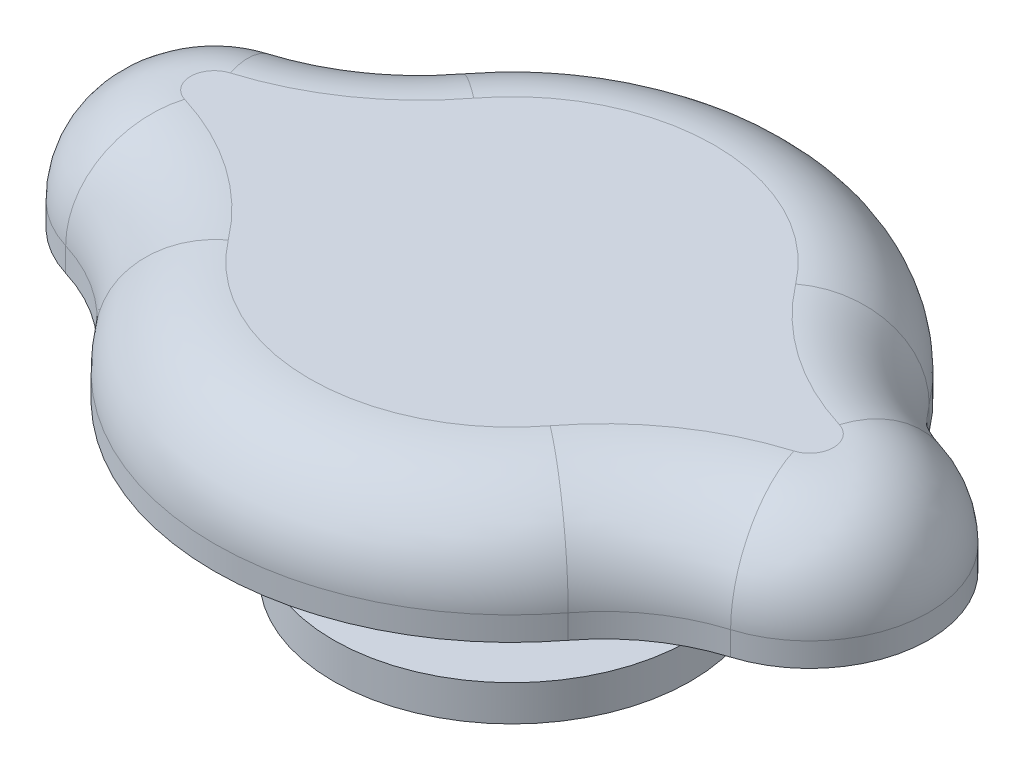
from build123d import *

# Parameters (mm, degrees)
SKETCH1_R           = 9.525
BOSS_EXTRUDE1_DEPTH = 1.27
BOSS_EXTRUDE3_START = 0.635
SKETCH2_R           = 9.525
BOSS_EXTRUDE3_DEPTH = 0.635
SKETCH3_R           = 6.35
BOSS_EXTRUDE4_DEPTH = 0.635
FILLET1_R           = 10.16
SKETCH4_R           = 3.175
BOSS_EXTRUDE5_DEPTH = 0.3175
SKETCH6_R           = 15.875
BOSS_EXTRUDE7_DEPTH = 6.35
SKETCH7_R           = 6.35
BOSS_EXTRUDE8_DEPTH = 6.35
FILLET2_R           = 10.16
FILLET3_R           = 5.08
SHELL1_T            = -0.635
BOSS_EXTRUDE9_REACH = 32.121
SKETCH5_R           = 3.175
SWEEP1_PITCH        = 5.588
SWEEP1_HEIGHT       = 11.176
SWEEP1_RADIUS       = 7.9375
SWEEP1_START_ANGLE  = -180
SKETCH10_R          = 0.635


with BuildPart() as part:
    # Sketch1 → Boss-Extrude1 (new body)
    with BuildSketch(Plane(origin=(0, 0, 0), x_dir=(1, 0, 0), z_dir=(0, 1, 0))):
        with Locations(Location((0, 0, 0), (0, 0, 270))):
            Circle(SKETCH1_R)
    extrude(amount=BOSS_EXTRUDE1_DEPTH)

    # Sketch2 → Boss-Extrude3 (add)
    with BuildSketch(Plane.XZ.offset(BOSS_EXTRUDE3_START)):
        with Locations(Location((0, 0, 0), (0, 0, 270))):
            Circle(SKETCH2_R)
    extrude(amount=-BOSS_EXTRUDE3_DEPTH)

    # Sketch3 → Boss-Extrude4 (add)
    with BuildSketch(Plane.XZ.offset(0.635)):
        with Locations(Location((0, 0, 0), (0, 0, 270))):
            Circle(SKETCH3_R)
    extrude(amount=BOSS_EXTRUDE4_DEPTH)

    # Fillet1
    # the kernel refuses this fillet: 10.16 mm, written as the material it takes off along each edge
    with BuildSketch(Plane(origin=(0, -1.27, 0), x_dir=(0, 0, -1), z_dir=(-1, 0, 0))) as fillet1_piece_1:
        with BuildLine():
            CenterArc((2.81446963, -10.16), FILLET1_R, 69.635865194, 20.364134806)
            Line((2.81446963, 0), (2.81446963, 0.2032))
            Line((2.81446963, 0.2032), (6.35, 0.2032))
            Line((6.35, 0.2032), (6.5532, 0))
            ThreePointArc((6.5532, 0), (6.5532, -0.3175), (6.420710607, -0.4445))
            Line((6.420710607, -0.4445), (6.35, -0.635))
        make_face()
    revolve(axis=Axis((0, -1.27, 0), (0, -1, 0)), mode=Mode.SUBTRACT)

    # Sketch4 → Boss-Extrude5 (add)
    with BuildSketch(Plane.XZ.offset(1.27)):
        with Locations(Location((0, 0, 0), (0, 0, 270))):
            Circle(SKETCH4_R)
    extrude(amount=BOSS_EXTRUDE5_DEPTH)


with BuildPart() as body_2:
    # Sketch6 → Boss-Extrude7 (new body)
    with BuildSketch(Plane(origin=(0, 7.62, 0), x_dir=(-1, 0, 0), z_dir=(0, 1, 0))):
        with Locations(Location((0, 0, 0), (0, 0, 90))):
            Circle(SKETCH6_R)
    extrude(amount=BOSS_EXTRUDE7_DEPTH)

    # Sketch7 → Boss-Extrude8 (add)
    with BuildSketch(Plane(origin=(0, 13.97, 0), x_dir=(1, 0, 0), z_dir=(0, 1, 0))):
        with Locations((-15.875, 0)):
            Circle(SKETCH7_R)
        with Locations((15.875, 0)):
            Circle(SKETCH7_R)
    extrude(amount=-BOSS_EXTRUDE8_DEPTH)

    # Fillet2
    fillet2_edges = [body_2.edges().sort_by_distance(p)[0] for p in [
        (14.605, 10.795, 6.221703947),
        (14.605, 10.795, -6.221703947),
        (-14.605, 10.795, -6.221703947),
        (-14.605, 10.795, 6.221703947),
    ]]
    fillet(fillet2_edges, radius=FILLET2_R)

    # Fillet3
    fillet3_edges = [body_2.edges().sort_by_distance(p)[0] for p in [
        (0, 13.97, -15.875),
        (22.225, 13.97, 0),
        (0, 13.97, 15.875),
        (-22.225, 13.97, 0),
        (14.897968618, 13.97, -7.449224743),
        (14.897968618, 13.97, 7.449224743),
        (-14.897968618, 13.97, -7.449224743),
        (-14.897968618, 13.97, 7.449224743),
    ]]
    fillet(fillet3_edges, radius=FILLET3_R)

    # Shell1
    shell1_openings = [body_2.faces().sort_by_distance(p)[0] for p in [
        (0, 7.62, 0),
    ]]
    offset(amount=SHELL1_T, openings=shell1_openings)

    # Sketch5 → Boss-Extrude9 (add, up to next)
    with BuildSketch(Plane(origin=(0, 1.27, 0), x_dir=(1, 0, 0), z_dir=(0, 1, 0)), mode=Mode.PRIVATE) as boss_extrude9_sk1:
        with Locations(Location((0, 0, 0), (0, 0, 90))):
            Circle(SKETCH5_R)
    boss_extrude9_tool1 = extrude(boss_extrude9_sk1.sketch, amount=BOSS_EXTRUDE9_REACH, mode=Mode.PRIVATE) - body_2.part

    add(part.part)  # Boss-Extrude9 merges part
    add(boss_extrude9_tool1.solids().sort_by_distance((0, 1.27, 0))[0])

    # Sweep1: sweep along a helix
    with BuildLine() as sweep1_path:
        add(Helix(SWEEP1_PITCH, SWEEP1_HEIGHT, SWEEP1_RADIUS, center=(0, 1.27, 0), direction=(0, 1, 0), lefthand=True, mode=Mode.PRIVATE).rotate(Axis((0, 1.27, 0), (0, 1, 0)), SWEEP1_START_ANGLE))
    # Sketch10 → Sweep1 (sweep)
    with BuildSketch(Plane(origin=(0, 0, 0), x_dir=(0, 0, -1), z_dir=(1, 0, 0))):
        with Locations((7.9375, 1.27)):
            Circle(SKETCH10_R)
    sweep(path=sweep1_path.line, is_frenet=True)


solid = body_2.part
